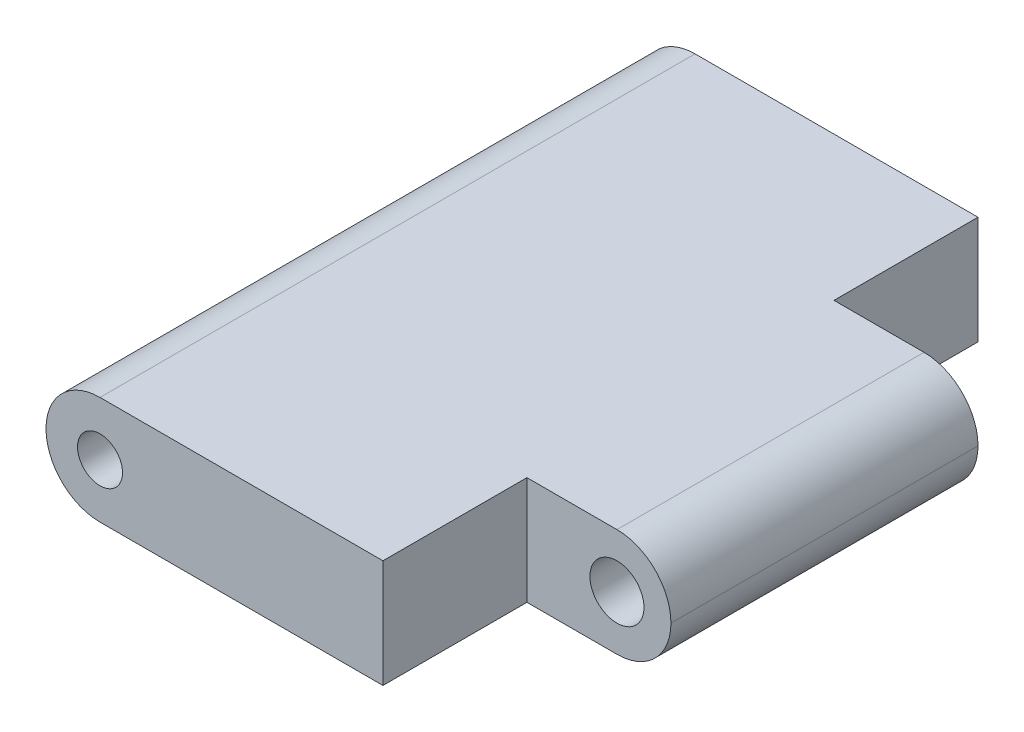
from build123d import *

# Parameters (mm, degrees)
SKETCH1_W           = 13.359057051
SKETCH1_H           = 16.529002792
BOSS_EXTRUDE1_DEPTH = 3
SKETCH2_W           = 4
SKETCH2_H           = 4
CUT_EXTRUDE1_DEPTH  = 22.463278841
FILLET1_R           = 1.5
SKETCH5_R           = 0.625
SKETCH5_R_2         = 0.75
CUT_EXTRUDE3_DEPTH  = 22.463278841
SCALE1_SCALE        = 1.3


with BuildPart() as part:
    # Sketch1 → Boss-Extrude1 (new body)
    with BuildSketch(Plane(origin=(0, 0, 0), x_dir=(1, 0, 0), z_dir=(0, 1, 0))):
        with Locations((6.679528526, 8.264501396)):
            Rectangle(SKETCH1_W, SKETCH1_H)
    extrude(amount=BOSS_EXTRUDE1_DEPTH)

    # Sketch2 → Cut-Extrude1 (cut, through all)
    with BuildSketch(Plane(origin=(0, 3, 0), x_dir=(1, 0, 0), z_dir=(0, 1, 0))):
        with Locations((11.359057051, 14.529002792)):
            Rectangle(SKETCH2_W, SKETCH2_H)
        with Locations((11.359057051, 2)):
            Rectangle(SKETCH2_W, SKETCH2_H)
    extrude(amount=-CUT_EXTRUDE1_DEPTH, mode=Mode.SUBTRACT)

    # Fillet1
    fillet1_edges = [part.edges().sort_by_distance(p)[0] for p in [
        (13.359057051, 0, -8.264501396),
        (13.359057051, 3, -8.264501396),
        (0, 0, -8.264501396),
        (0, 3, -8.264501396),
    ]]
    fillet(fillet1_edges, radius=FILLET1_R - 0.0001)  # a hair under: the kernel refuses the full size

    # Sketch5 → Cut-Extrude3 (cut, through all)
    with BuildSketch(Plane.XY):
        with Locations((1.5, 1.5)):
            Circle(SKETCH5_R)
        with Locations((11.859057051, 1.5)):
            Circle(SKETCH5_R_2)
    extrude(amount=-CUT_EXTRUDE3_DEPTH, mode=Mode.SUBTRACT)


with BuildPart() as part_1:
    # Scale1: scaled about (5.943207595, 1.5, -8.264501396)
    add(part.part.scale(SCALE1_SCALE).moved(Location((-1.782962279, -0.45, 2.479350419))))


solid = part_1.part
